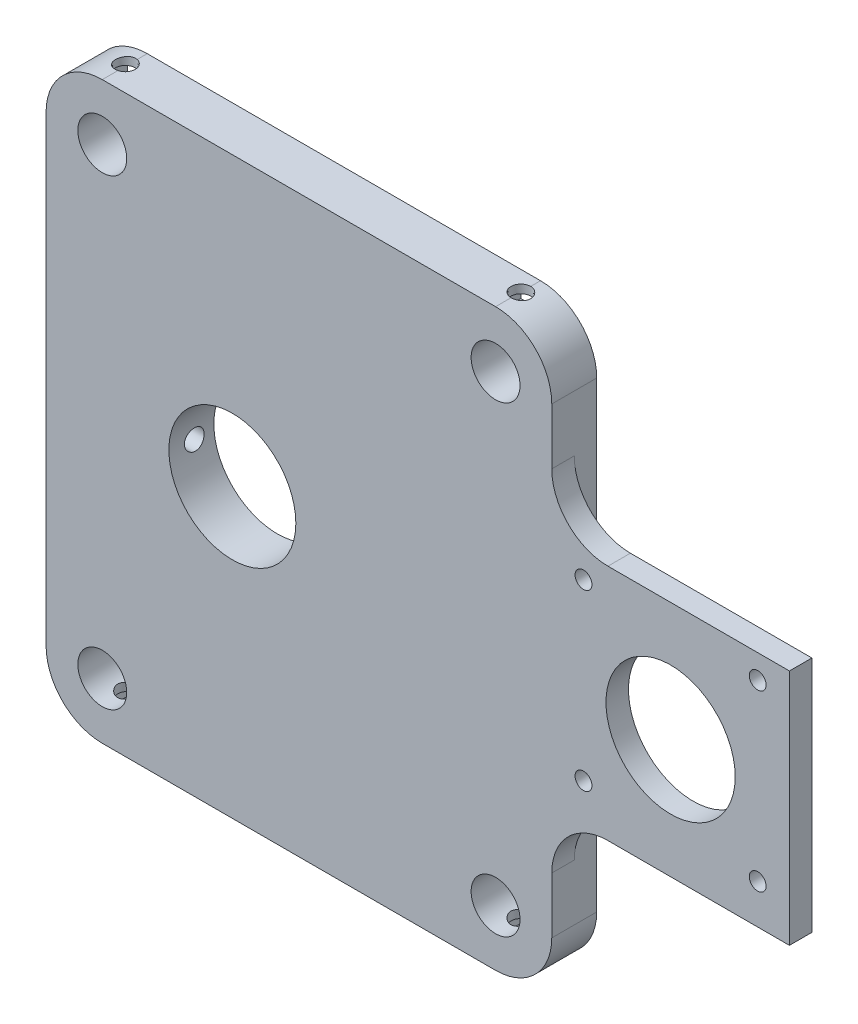
from build123d import *
from OCP.BRepAlgoAPI import BRepAlgoAPI_Cut
from OCP.TopTools import TopTools_ListOfShape

# Parameters (mm, degrees)
CROQUIS1_R              = 11.5
CROQUIS1_R_2            = 1.5
CROQUIS1_R_3            = 11.3
CROQUIS1_R_4            = 4.35
SALIENTE_EXTRUIR1_DEPTH = 8
CROQUIS2_W              = 42.3
CROQUIS2_H              = 82.3
CORTAR_EXTRUIR1_DEPTH   = 4
CROQUIS3_W              = 7
CROQUIS3_H              = 3
CROQUIS3_W_2            = 3.5
CROQUIS3_H_2            = 8
CORTAR_EXTRUIR2_DEPTH   = 7
CORTAR_EXTRUIR4_START   = 43.694121903
CORTAR_EXTRUIR4_DEPTH   = 11.305878097
CORTAR_EXTRUIR5_START   = 43.694121903
CORTAR_EXTRUIR5_DEPTH   = 11.305878097
CORTAR_EXTRUIR6_START   = -35
CROQUIS6_R              = 1.75
CORTAR_EXTRUIR6_DEPTH   = 23
CORTAR_EXTRUIR7_START   = 0.389048
CROQUIS7_R              = 1.75
CORTAR_EXTRUIR7_DEPTH   = 22.090368


with BuildPart() as part:
    # Croquis1 → Saliente-Extruir1 (new body)
    with BuildSketch(Plane.XY):
        with BuildLine():
            Line((90.389048187, -28.605878097), (90.389048187, -38.605878097))
            ThreePointArc((90.389048187, -38.605878097), (87.460115999, -45.676945909), (80.389048187, -48.605878097))
            Line((80.389048187, -48.605878097), (10.389048187, -48.605878097))
            ThreePointArc((10.389048187, -48.605878097), (3.317980376, -45.676945909), (0.389048187, -38.605878097))
            Line((0.389048187, -38.605878097), (0.389048187, 43.694121903))
            ThreePointArc((0.389048187, 43.694121903), (3.317980376, 50.765189715), (10.389048187, 53.694121903))
            Line((10.389048187, 53.694121903), (80.389048187, 53.694121903))
            ThreePointArc((80.389048187, 53.694121903), (87.460115999, 50.765189715), (90.389048187, 43.694121903))
            Line((90.389048187, 43.694121903), (90.389048187, 33.694121903))
            ThreePointArc((90.389048187, 33.694121903), (93.317980376, 26.623054091), (100.389048187, 23.694121903))
            Line((100.389048187, 23.694121903), (132.689048187, 23.694121903))
            Line((132.689048187, 23.694121903), (132.689048187, -18.605878097))
            Line((132.689048187, -18.605878097), (100.389048187, -18.605878097))
            ThreePointArc((100.389048187, -18.605878097), (93.317980376, -21.534810285), (90.389048187, -28.605878097))
        make_face()
        with Locations((111.539048187, 2.544121903)):
            Circle(CROQUIS1_R, mode=Mode.SUBTRACT)
        with Locations((127.039048187, 19.433464916)):
            Circle(CROQUIS1_R_2, mode=Mode.SUBTRACT)
        with Locations((96.039048187, 19.433464916)):
            Circle(CROQUIS1_R_2, mode=Mode.SUBTRACT)
        with Locations((96.039048187, -11.566535084)):
            Circle(CROQUIS1_R_2, mode=Mode.SUBTRACT)
        with Locations((127.039048187, -11.566535084)):
            Circle(CROQUIS1_R_2, mode=Mode.SUBTRACT)
        with Locations((33.539048187, 2.544121903)):
            Circle(CROQUIS1_R_3, mode=Mode.SUBTRACT)
        with Locations((10.389048187, 43.694121903)):
            Circle(CROQUIS1_R_4, mode=Mode.SUBTRACT)
        with Locations((80.389048187, 43.694121903)):
            Circle(CROQUIS1_R_4, mode=Mode.SUBTRACT)
        with Locations((10.389048187, -38.605878097)):
            Circle(CROQUIS1_R_4, mode=Mode.SUBTRACT)
        with Locations((80.389048187, -38.605878097)):
            Circle(CROQUIS1_R_4, mode=Mode.SUBTRACT)
    extrude(amount=SALIENTE_EXTRUIR1_DEPTH)

    # Croquis2 → Cortar-Extruir1 (cut)
    with BuildSketch(Plane.XY):
        with Locations((111.539048187, 2.544121903)):
            Rectangle(CROQUIS2_W, CROQUIS2_H)
    extrude(amount=CORTAR_EXTRUIR1_DEPTH, mode=Mode.SUBTRACT)

    # Croquis3 → Cortar-Extruir2 (cut)
    with BuildSketch(Plane.XY):
        with Locations((10.389048187, 50.694121903)):
            Rectangle(CROQUIS3_W, CROQUIS3_H)
        with Locations((80.389048187, 50.694121903)):
            Rectangle(CROQUIS3_W, CROQUIS3_H)
        with Locations((10.389048187, -45.605878097)):
            Rectangle(CROQUIS3_W, CROQUIS3_H)
        with Locations((80.389048187, -45.605878097)):
            Rectangle(CROQUIS3_W, CROQUIS3_H)
        with Locations((13.539048187, 2.544121903)):
            Rectangle(CROQUIS3_W_2, CROQUIS3_H_2)
    extrude(amount=CORTAR_EXTRUIR2_DEPTH, mode=Mode.SUBTRACT)

    # Cortar-Extruir4: read off the stored shape, not the designer's step
    # Cortar-Extruir4 outline → Cortar-Extruir4 (cut)
    with BuildSketch(Plane(origin=(0, 0, 0), x_dir=(1, 0, 0), z_dir=(0, 1, 0)).offset(CORTAR_EXTRUIR4_START)):
        with BuildLine():
            add(Edge.make_bspline(
                [(10, -1.75), (10.466963096, -1.75), (10.925817058, -1.945958796), (11.568319308, -2.598581209), (11.755931548, -3.058061383), (11.743768961, -3.987724464), (11.543658031, -4.4434418), (10.882294622, -5.079404554), (10.413932458, -5.261541677), (9.493668374, -5.237238453), (9.052176088, -5.037857128), (8.429631099, -4.392925658), (8.244353906, -3.940515747), (8.255919777, -3.015715473), (8.452338784, -2.567615644), (9.093334173, -1.937133113), (9.533036904, -1.75), (10, -1.75)],
                knots=[0, 0, 0, 0, 0.125, 0.125, 0.25, 0.25, 0.375, 0.375, 0.5, 0.5, 0.625, 0.625, 0.75, 0.75, 0.875, 0.875, 1, 1, 1, 1], degree=3))
        make_face()
    extrude(amount=CORTAR_EXTRUIR4_DEPTH, mode=Mode.SUBTRACT)

    # Cortar-Extruir5: read off the stored shape, not the designer's step
    # Cortar-Extruir5 outline → Cortar-Extruir5 (cut)
    with BuildSketch(Plane(origin=(0, 0, 0), x_dir=(1, 0, 0), z_dir=(0, 1, 0)).offset(CORTAR_EXTRUIR5_START)):
        with BuildLine():
            add(Edge.make_bspline(
                [(80.389048187, -1.75), (80.856745378, -1.75), (81.307898112, -1.943731362), (81.946021688, -2.582344959), (82.138515507, -3.035924965), (82.139578552, -3.960048893), (81.94704045, -4.416608445), (81.30698381, -5.057210688), (80.85156655, -5.249506943), (79.930268473, -5.25049106), (79.474562929, -5.060357282), (78.828779255, -4.41463599), (78.639361405, -3.96268404), (78.638735774, -3.039688355), (78.829700425, -2.584942834), (79.471719554, -1.941987407), (79.921350997, -1.75), (80.389048187, -1.75)],
                knots=[0, 0, 0, 0, 0.125, 0.125, 0.25, 0.25, 0.375, 0.375, 0.5, 0.5, 0.625, 0.625, 0.75, 0.75, 0.875, 0.875, 1, 1, 1, 1], degree=3))
        make_face()
    extrude(amount=CORTAR_EXTRUIR5_DEPTH, mode=Mode.SUBTRACT)

    # Croquis6 → Cortar-Extruir6 (cut)
    with BuildSketch(Plane(origin=(0, 0, 0), x_dir=(1, 0, 0), z_dir=(0, 1, 0)).offset(CORTAR_EXTRUIR6_START)):
        with Locations(Location((10.389048187, -3.5, 0), (0, 0, 270))):
            Circle(CROQUIS6_R)
        with Locations(Location((80.389048187, -3.5, 0), (0, 0, 270))):
            Circle(CROQUIS6_R)
    extrude(amount=-CORTAR_EXTRUIR6_DEPTH, mode=Mode.SUBTRACT)


with BuildPart() as cortar_extruir7_tool:
    # Croquis7 → Cortar-Extruir7 (new body)
    with BuildSketch(Plane(origin=(0, 0, 0), x_dir=(0, 0, -1), z_dir=(1, 0, 0)).offset(CORTAR_EXTRUIR7_START)):
        with Locations(Location((-3.5, 1.975806023, 0), (0, 0, 180))):
            Circle(CROQUIS7_R)
    extrude(amount=CORTAR_EXTRUIR7_DEPTH)


with BuildPart() as part_1:
    add(part.part)

    # Cortar-Extruir7: cut by cortar_extruir7_tool, with a tolerance
    cortar_extruir7_stock = TopTools_ListOfShape()
    cortar_extruir7_stock.Append(part_1.part.wrapped)
    cortar_extruir7_tools = TopTools_ListOfShape()
    cortar_extruir7_tools.Append(cortar_extruir7_tool.part.wrapped)
    cortar_extruir7_cut = BRepAlgoAPI_Cut()
    cortar_extruir7_cut.SetArguments(cortar_extruir7_stock)
    cortar_extruir7_cut.SetTools(cortar_extruir7_tools)
    cortar_extruir7_cut.SetFuzzyValue(0.00001)
    cortar_extruir7_cut.Build()
    add(Compound.cast(cortar_extruir7_cut.Shape()).solids(), mode=Mode.REPLACE)


solid = part_1.part
